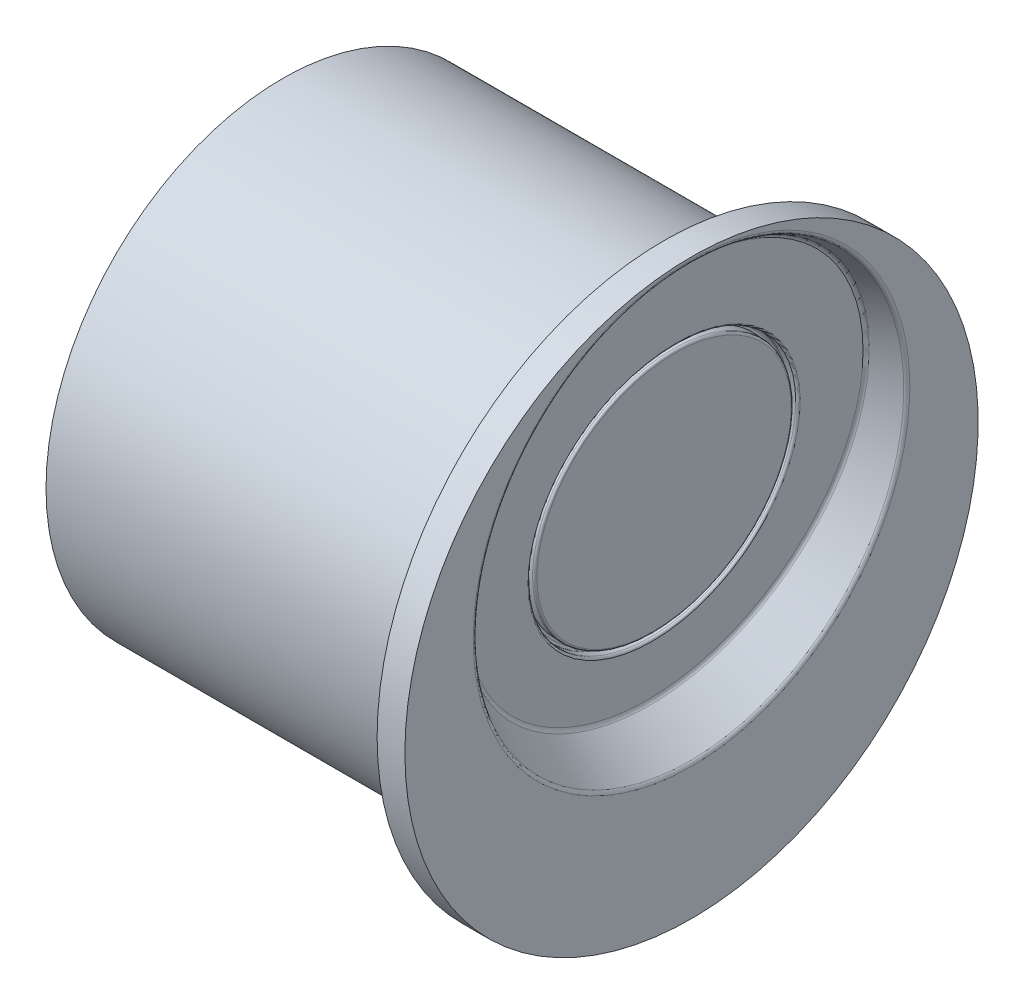
from build123d import *

# Parameters (mm, degrees)
CUT_EXTRUDE_1_DEPTH      = 27.64630158
CUT_EXTRUDE_1_DEPTH_BACK = 1.5
SKETCH_2_R               = 9
FILLET_1_R               = 0.2
SKETCH_3_R               = 6
SKETCH_3_R_2             = 5.8
CUT_EXTRUDE_2_DEPTH      = 0.5
FILLET_2_R               = 0.1
SKETCH_4_R               = 1.5
EXTRUDE_1_DEPTH          = 2


# Read off the part's stored shape, not the designer's step: Уклон1
with BuildPart() as part:
    # Эскиз1 → Повернуть1 (revolve)
    with BuildSketch(Plane.XY, mode=Mode.PRIVATE) as revolve_1_sk:
        Polygon((0, 0), (0, 10.65), (17.15, 10.65), (17.15, 12.9), (18.4, 12.9), (18.4, 0), align=None)
    revolve(revolve_1_sk.sketch.rotate(Axis((0, 0, 0), (1, 0, 0)), 90), axis=Axis((0, 0, 0), (1, 0, 0)))

    # Эскиз2 → Вырез-Вытянуть1 (cut, two sides: drawn at the far end of the back side and taken through both)
    with BuildSketch(Plane(origin=(18.260231328, -1.597563235, 0), x_dir=(0, 0, -1), z_dir=(0.9961946980917455, -0.08715574274765836, 0)).offset(-CUT_EXTRUDE_1_DEPTH_BACK)):
        with Locations(Location((0, 4.982416031, 0), (0, 0, 90))):
            Circle(SKETCH_2_R)
    extrude(amount=CUT_EXTRUDE_1_DEPTH + CUT_EXTRUDE_1_DEPTH_BACK, mode=Mode.SUBTRACT)

    # Уклон1 outline → Уклон1 (revolve, cut)
    with BuildSketch(Plane(origin=(0.43424617, 4.963456434, 0), x_dir=(0.08715574274765836, 0.9961946980917454, 0), z_dir=(0, 0, -1))):
        Polygon((9, 16.829982445), (10.211394412, 18.928179115), (9, 18.928179115), align=None)
    revolve(axis=Axis((0.43424617, 4.963456434, 0), (0.9961946980917454, -0.08715574274765836, 0)), mode=Mode.SUBTRACT)

    # Скругление1
    fillet_1_edges = [part.edges().sort_by_distance(p)[0] for p in [
        (16.415783766, -5.469125469, 0),
        (18.4, -6.858488634, -5.8e-08),
    ]]
    fillet(fillet_1_edges, radius=FILLET_1_R)

    # Эскиз3 → Вырез-Вытянуть2 (cut)
    with BuildSketch(Plane(origin=(16.765939281, -1.46682962, 0), x_dir=(0, 0, -1), z_dir=(0.9961946980917457, -0.08715574274765837, 0))):
        with Locations(Location((0, 4.591293403, 0), (0, 0, 90))):
            Circle(SKETCH_3_R)
        with Locations(Location((0, 4.591293403, 0), (0, 0, 90))):
            Circle(SKETCH_3_R_2, mode=Mode.SUBTRACT)
    extrude(amount=-CUT_EXTRUDE_2_DEPTH, mode=Mode.SUBTRACT)

    # Скругление2
    fillet_2_edges = [part.edges().sort_by_distance(p)[0] for p in [
        (16.145065062, -2.826597792, 0),
        (16.643162411, -2.870175664, 0),
        (16.660593559, -2.670936724, 0),
    ]]
    fillet(fillet_2_edges, radius=FILLET_2_R)

    # Эскиз4 → Бобышка-Вытянуть1 (add)
    with BuildSketch(Plane.ZY):
        with Locations(Location((0, -8.520441642, 0), (0, 0, 180))):
            Circle(SKETCH_4_R)
    extrude(amount=EXTRUDE_1_DEPTH)


solid = part.part
